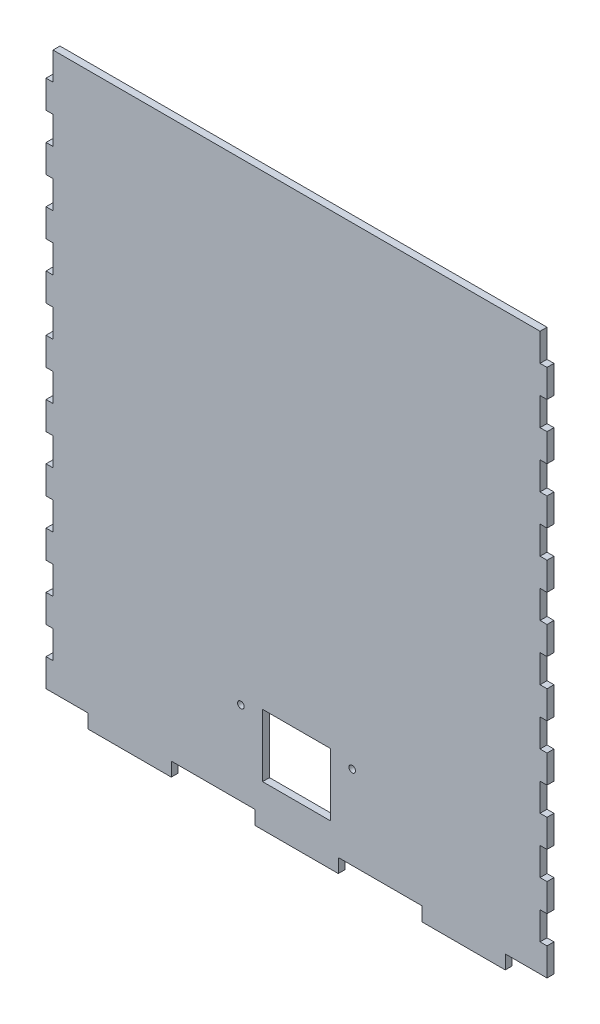
from build123d import *

# Parameters (mm, degrees)
SKETCH1_W           = 3.175
SKETCH1_H           = 12.7
SKETCH1_W_2         = 38.1
SKETCH1_H_2         = 6.35
BOSS_EXTRUDE1_DEPTH = 3.175
SKETCH2_R           = 1.5
SKETCH2_W           = 31
SKETCH2_H           = 28.575
CUT_EXTRUDE1_DEPTH  = 176.661017659


with BuildPart() as part:
    # Sketch1 → Boss-Extrude1 (new body)
    with BuildSketch(Plane.XY):
        Polygon((-111.125, 127), (-111.125, 114.3), (-111.125, 101.6), (-111.125, 88.9), (-111.125, 76.2), (-111.125, 63.5), (-111.125, 50.8), (-111.125, 38.1), (-111.125, 25.4), (-111.125, 12.7), (-111.125, 0), (-111.125, -12.7), (-111.125, -25.4), (-111.125, -38.1), (-111.125, -50.8), (-111.125, -63.5), (-111.125, -76.2), (-111.125, -88.9), (-111.125, -101.6), (-111.125, -114.3), (-111.125, -127), (-95.25, -127), (-57.15, -127), (-19.05, -127), (0, -127), (0, 127), align=None)
        Polygon((111.125, 127), (0, 127), (0, -127), (19.05, -127), (57.15, -127), (95.25, -127), (111.125, -127), (111.125, -114.3), (111.125, -101.6), (111.125, -88.9), (111.125, -76.2), (111.125, -63.5), (111.125, -50.8), (111.125, -38.1), (111.125, -25.4), (111.125, -12.7), (111.125, 0), (111.125, 12.7), (111.125, 25.4), (111.125, 38.1), (111.125, 50.8), (111.125, 63.5), (111.125, 76.2), (111.125, 88.9), (111.125, 101.6), (111.125, 114.3), align=None)
        with Locations((-112.7125, -120.65)):
            Rectangle(SKETCH1_W, SKETCH1_H)
        with Locations((-112.7125, -95.25)):
            Rectangle(SKETCH1_W, SKETCH1_H)
        with Locations((-112.7125, -69.85)):
            Rectangle(SKETCH1_W, SKETCH1_H)
        with Locations((-112.7125, -44.45)):
            Rectangle(SKETCH1_W, SKETCH1_H)
        with Locations((-112.7125, -19.05)):
            Rectangle(SKETCH1_W, SKETCH1_H)
        with Locations((-112.7125, 6.35)):
            Rectangle(SKETCH1_W, SKETCH1_H)
        with Locations((-112.7125, 31.75)):
            Rectangle(SKETCH1_W, SKETCH1_H)
        with Locations((-112.7125, 57.15)):
            Rectangle(SKETCH1_W, SKETCH1_H)
        with Locations((-112.7125, 82.55)):
            Rectangle(SKETCH1_W, SKETCH1_H)
        with Locations((-112.7125, 107.95)):
            Rectangle(SKETCH1_W, SKETCH1_H)
        with Locations((112.7125, -120.65)):
            Rectangle(SKETCH1_W, SKETCH1_H)
        with Locations((112.7125, -95.25)):
            Rectangle(SKETCH1_W, SKETCH1_H)
        with Locations((112.7125, -69.85)):
            Rectangle(SKETCH1_W, SKETCH1_H)
        with Locations((112.7125, -44.45)):
            Rectangle(SKETCH1_W, SKETCH1_H)
        with Locations((112.7125, -19.05)):
            Rectangle(SKETCH1_W, SKETCH1_H)
        with Locations((112.7125, 6.35)):
            Rectangle(SKETCH1_W, SKETCH1_H)
        with Locations((112.7125, 31.75)):
            Rectangle(SKETCH1_W, SKETCH1_H)
        with Locations((112.7125, 57.15)):
            Rectangle(SKETCH1_W, SKETCH1_H)
        with Locations((112.7125, 82.55)):
            Rectangle(SKETCH1_W, SKETCH1_H)
        with Locations((112.7125, 107.95)):
            Rectangle(SKETCH1_W, SKETCH1_H)
        with Locations((76.2, -130.175)):
            Rectangle(SKETCH1_W_2, SKETCH1_H_2)
        Polygon((19.05, -127), (0, -127), (-19.05, -127), (-19.05, -133.35), (19.05, -133.35), align=None)
        with Locations((-76.2, -130.175)):
            Rectangle(SKETCH1_W_2, SKETCH1_H_2)
    extrude(amount=BOSS_EXTRUDE1_DEPTH)

    # Sketch2 → Cut-Extrude1 (cut, through all)
    with BuildSketch(Plane.XY.offset(3.175)):
        with Locations((-25.4, -88.9)):
            Circle(SKETCH2_R)
        with Locations((25.4, -88.9)):
            Circle(SKETCH2_R)
        with Locations((0, -100.0125)):
            Rectangle(SKETCH2_W, SKETCH2_H)
    extrude(amount=-CUT_EXTRUDE1_DEPTH, mode=Mode.SUBTRACT)


solid = part.part
